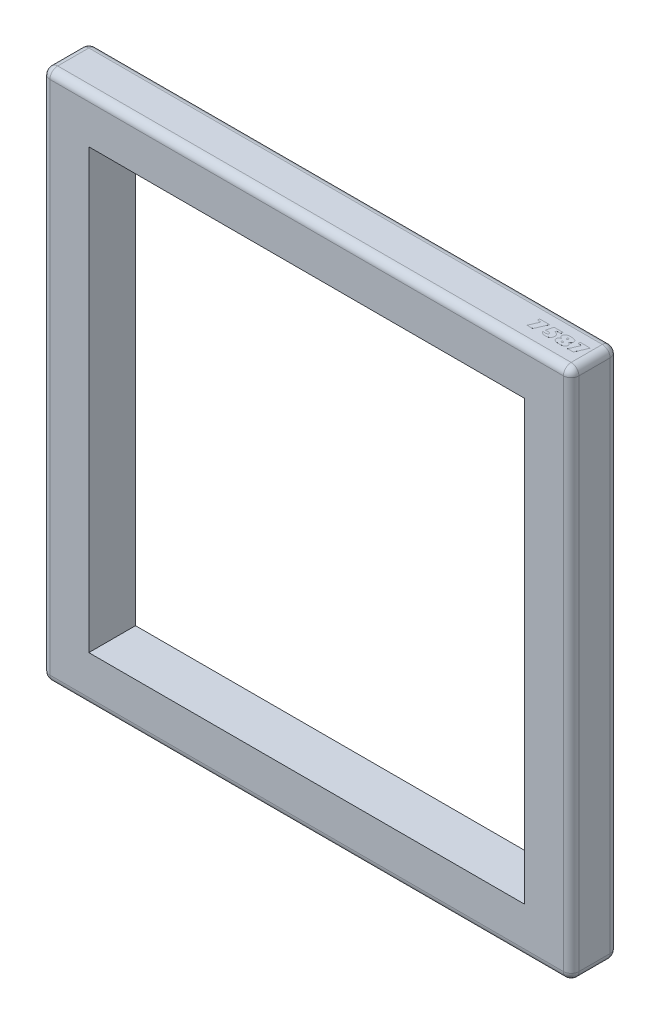
from build123d import *

# Parameters (mm, degrees)
SKETCH2_W           = 863.6
SKETCH2_H           = 867.537
SKETCH2_W_2         = 711.2
SKETCH2_H_2         = 715.137
BOSS_EXTRUDE1_DEPTH = 76.2
FILLET1_R           = 12.7
BOSS_EXTRUDE2_DEPTH = 0.0254


with BuildPart() as part:
    # Sketch2 → Boss-Extrude1 (new body)
    with BuildSketch(Plane.XY):
        with Locations((-393.7, 357.5685)):
            Rectangle(SKETCH2_W, SKETCH2_H)
        with Locations((-393.7, 357.5685)):
            Rectangle(SKETCH2_W_2, SKETCH2_H_2, mode=Mode.SUBTRACT)
    extrude(amount=-BOSS_EXTRUDE1_DEPTH)

    # Fillet1
    fillet1_edges = [part.edges().sort_by_distance(p)[0] for p in [
        (-825.5, 357.5685, 0),
        (-393.7, -76.2, -76.2),
        (38.1, -76.2, -38.1),
        (-393.7, -76.2, 0),
        (-825.5, -76.2, -38.1),
        (-825.5, 357.5685, -76.2),
        (38.1, 357.5685, -76.2),
        (-393.7, 791.337, -76.2),
        (38.1, 791.337, -38.1),
        (-825.5, 791.337, -38.1),
        (-393.7, 791.337, 0),
        (38.1, 357.5685, 0),
    ]]
    fillet(fillet1_edges, radius=FILLET1_R)

    # Sketch3 → Boss-Extrude2 (add)
    # profile 1 of 4: a face of its own
    with BuildSketch(Plane(origin=(0, 791.337, 0), x_dir=(1, 0, 0), z_dir=(0, 1, 0))):
        Polygon((-53.727973938, 29.183715642), (-63.107004166, 29.183715642), (-56.273603439, 45.043212712), (-61.845453262, 45.043212712), (-61.845453262, 48.407348454), (-45.445291519, 48.407348454), align=None)
    # profile 2 of 4: a face of its own
    with BuildSketch(Plane(origin=(0, 791.337, 0), x_dir=(1, 0, 0), z_dir=(0, 1, 0))):
        with BuildLine():
            Line((-23.878778458, 48.407348454), (-23.878778458, 45.043212712))
            Line((-23.878778458, 45.043212712), (-30.415564537, 45.043212712))
            Line((-30.415564537, 45.043212712), (-31.087640762, 42.3999632))
            add(Edge.make_bspline(
                [(-31.087640762, 42.3999632), (-30.831811244, 42.379100971), (-30.334066113, 42.338511156), (-29.614826101, 42.209941881), (-28.940065984, 42.049535514), (-28.313604943, 41.833604056), (-27.732477764, 41.574614404), (-27.194899243, 41.270210143), (-26.706602743, 40.916008536), (-26.263625689, 40.520640154), (-25.875107785, 40.083089795), (-25.528510647, 39.617600592), (-25.243902994, 39.112435936), (-25.003916003, 38.578369918), (-24.826649975, 38.007590908), (-24.693993169, 37.407561962), (-24.614139054, 36.775192587), (-24.604552672, 36.342745372), (-24.599664688, 36.12224561)],
                knots=[0, 0, 0, 0, 1.217686971, 2.369147101, 3.464164001, 4.50681488, 5.509294206, 6.480446105, 7.433459119, 8.367357942, 9.292867885, 10.206577389, 11.116571509, 12.039427559, 12.980684995, 13.947849621, 14.953632596, 16, 16, 16, 16], degree=3))
            add(Edge.make_bspline(
                [(-24.599664688, 36.12224561), (-24.607417191, 35.866624391), (-24.622647202, 35.364449315), (-24.726758385, 34.626809341), (-24.913647914, 33.927084456), (-25.164264692, 33.258886209), (-25.495528697, 32.630585214), (-25.890779335, 32.030279269), (-26.367533148, 31.472437933), (-26.907128117, 30.952217408), (-27.5014239, 30.479052042), (-28.146940343, 30.071337705), (-28.828230186, 29.717451143), (-29.554837166, 29.437932283), (-30.319333275, 29.214234944), (-31.125350741, 29.060413609), (-31.971060297, 28.957337583), (-32.549116472, 28.948130033), (-32.844800949, 28.943420232)],
                knots=[0, 0, 0, 0, 1.001936993, 1.968333403, 2.91189952, 3.835723145, 4.759455594, 5.690079001, 6.647318133, 7.629130035, 8.624331341, 9.619109397, 10.617364864, 11.628542224, 12.665579242, 13.7353975, 14.841621563, 16, 16, 16, 16], degree=3))
            add(Edge.make_bspline(
                [(-32.844800949, 28.943420232), (-33.101507962, 28.946487711), (-33.609386292, 28.952556522), (-34.36090623, 29.017180928), (-35.094759884, 29.107666611), (-35.810732408, 29.243612964), (-36.506867362, 29.420975914), (-37.18740516, 29.630616446), (-37.846794244, 29.882178444), (-38.481499361, 30.169794932), (-39.08043473, 30.484905918), (-39.617170269, 30.846322504), (-40.104486261, 31.223484988), (-40.525551786, 31.63756861), (-40.887652114, 32.081803708), (-41.18745197, 32.554303331), (-41.430573251, 33.056788661), (-41.54106327, 33.409780207), (-41.596810341, 33.587879956)],
                knots=[0, 0, 0, 0, 1.163667245, 2.302240872, 3.417871835, 4.515255233, 5.603932667, 6.673677212, 7.742352562, 8.801402191, 9.832207051, 10.806445689, 11.731706445, 12.622549934, 13.477799023, 14.324761977, 15.154768787, 16, 16, 16, 16], degree=3))
            Line((-41.596810341, 33.587879956), (-41.44662571, 33.749328435))
            add(Edge.make_bspline(
                [(-41.44662571, 33.749328435), (-41.104249796, 33.63762941), (-40.416252372, 33.413172495), (-39.345082895, 33.194536847), (-38.245246924, 33.053352598), (-37.500973816, 33.036801624), (-37.125062943, 33.028442204)],
                knots=[0, 0, 0, 0, 0.98115573, 1.97161245, 2.975519971, 4, 4, 4, 4], degree=3))
            add(Edge.make_bspline(
                [(-37.125062943, 33.028442204), (-36.984840212, 33.030849008), (-36.710328955, 33.03556076), (-36.307815406, 33.065254664), (-35.925067716, 33.116679868), (-35.564256733, 33.192651602), (-35.22342245, 33.285318922), (-34.904203976, 33.403114031), (-34.602547116, 33.536512813), (-34.324720328, 33.693984479), (-34.076237396, 33.869503965), (-33.853817736, 34.05306707), (-33.668442319, 34.254849344), (-33.514049055, 34.466848971), (-33.395103102, 34.692079501), (-33.312850774, 34.928892961), (-33.256625922, 35.177204271), (-33.252425165, 35.348480123), (-33.250299454, 35.435150922)],
                knots=[0, 0, 0, 0, 1.331593224, 2.606833628, 3.830465399, 4.995919138, 6.106066241, 7.181376235, 8.224006534, 9.235276467, 10.207957358, 11.110353994, 11.968214499, 12.802704758, 13.594817664, 14.376700065, 15.178560784, 16, 16, 16, 16], degree=3))
            add(Edge.make_bspline(
                [(-33.250299454, 35.435150922), (-33.252651667, 35.523014262), (-33.257227707, 35.693945228), (-33.308112247, 35.940282072), (-33.388112061, 36.170370919), (-33.498966651, 36.385388907), (-33.650408597, 36.576895155), (-33.824708625, 36.758332143), (-34.036164735, 36.917864746), (-34.279092805, 37.060081481), (-34.550936828, 37.189340622), (-34.857559896, 37.296040157), (-35.194637921, 37.390324528), (-35.564035453, 37.46311021), (-35.963426969, 37.524652246), (-36.396078022, 37.563221946), (-36.860618252, 37.59123405), (-37.1813343, 37.593095747), (-37.346585274, 37.594054997)],
                knots=[0, 0, 0, 0, 0.814446033, 1.584438367, 2.32285386, 3.071071758, 3.816851133, 4.580773861, 5.400915678, 6.265507767, 7.190421024, 8.189801626, 9.274824997, 10.436656683, 11.681899897, 13.023836303, 14.466512816, 16, 16, 16, 16], degree=3))
            add(Edge.make_bspline(
                [(-37.346585274, 37.594054997), (-37.530661765, 37.591326454), (-37.890626915, 37.585990735), (-38.417258544, 37.539809773), (-38.91561654, 37.466850854), (-39.385877264, 37.360118583), (-39.82764793, 37.22774345), (-40.240206811, 37.060220478), (-40.626339426, 36.866713218), (-40.863557527, 36.710330726), (-40.981053352, 36.632873357)],
                knots=[0, 0, 0, 0, 1.156825485, 2.262194689, 3.320222464, 4.320246568, 5.290750089, 6.21544117, 7.116095219, 8, 8, 8, 8], degree=3))
            Line((-40.981053352, 36.632873357), (-41.180047989, 36.801831067))
            Line((-41.180047989, 36.801831067), (-38.296503067, 48.407348454))
            Line((-38.296503067, 48.407348454), (-23.878778458, 48.407348454))
        make_face()
    # profile 3 of 4: a face of its own
    with BuildSketch(Plane(origin=(0, 791.337, 0), x_dir=(1, 0, 0), z_dir=(0, 1, 0))):
        with BuildLine():
            Line((-5.563762665, 38.68664819), (-5.563762665, 38.637838185))
            add(Edge.make_bspline(
                [(-5.563762665, 38.637838185), (-5.380573806, 38.595893009), (-5.024416344, 38.514342812), (-4.51227853, 38.364555617), (-4.035891823, 38.190912547), (-3.594381064, 37.996635171), (-3.185749403, 37.784052795), (-2.816605473, 37.544099577), (-2.476511515, 37.29119859), (-2.174128601, 37.012082439), (-1.910809561, 36.709619283), (-1.679492739, 36.388575451), (-1.482473103, 36.045854998), (-1.326295435, 35.67945723), (-1.199868114, 35.294328742), (-1.115710744, 34.886146416), (-1.061749026, 34.457890026), (-1.054436931, 34.165006958), (-1.050714493, 34.015906155)],
                knots=[0, 0, 0, 0, 1.272070742, 2.473171623, 3.609658422, 4.702216877, 5.736899567, 6.724002855, 7.679735686, 8.603071686, 9.503737951, 10.390184178, 11.278208182, 12.173798879, 13.08212411, 14.017702024, 14.990852492, 16, 16, 16, 16], degree=3))
            add(Edge.make_bspline(
                [(-1.050714493, 34.015906155), (-1.058150502, 33.803962751), (-1.072591266, 33.392367637), (-1.177907969, 32.796738677), (-1.358591913, 32.244512908), (-1.618310436, 31.738346992), (-1.941386363, 31.269651149), (-2.347747043, 30.854380611), (-2.82167441, 30.481178262), (-3.367733393, 30.147637793), (-3.996605242, 29.864640349), (-4.703146373, 29.613442668), (-5.49587634, 29.404772499), (-6.373542808, 29.239872428), (-7.335693888, 29.104993428), (-8.384327523, 29.00876957), (-9.518019777, 28.953534065), (-10.302025063, 28.946868361), (-10.707586289, 28.943420232)],
                knots=[0, 0, 0, 0, 0.829914899, 1.611698737, 2.360447216, 3.097077995, 3.832811089, 4.581671893, 5.363348137, 6.190638346, 7.081174267, 8.059558398, 9.124987239, 10.288298897, 11.555600899, 12.929230815, 14.411509545, 16, 16, 16, 16], degree=3))
            add(Edge.make_bspline(
                [(-10.707586289, 28.943420232), (-11.098148003, 28.946492508), (-11.853486991, 28.952434232), (-12.948369628, 29.012930794), (-13.965713708, 29.112780633), (-14.906847673, 29.251214746), (-15.772480556, 29.423018646), (-16.558975357, 29.644731025), (-17.268572819, 29.903521154), (-17.905364186, 30.196153588), (-18.460618911, 30.542000933), (-18.9488499, 30.920293491), (-19.359184058, 31.349810362), (-19.695500149, 31.821468574), (-19.959512369, 32.33568844), (-20.142572518, 32.893081029), (-20.253361517, 33.49213308), (-20.267230751, 33.90528503), (-20.274347305, 34.117280782)],
                knots=[0, 0, 0, 0, 1.536874697, 2.97228667, 4.313637076, 5.558361364, 6.714578418, 7.784185359, 8.770526994, 9.684887053, 10.536399623, 11.339456744, 12.10932516, 12.865089986, 13.611813465, 14.374988553, 15.166177183, 16, 16, 16, 16], degree=3))
            add(Edge.make_bspline(
                [(-20.274347305, 34.117280782), (-20.270200543, 34.26256821), (-20.262097812, 34.546458299), (-20.21452133, 34.963012537), (-20.126600439, 35.35842056), (-20.008816317, 35.736078895), (-19.847465092, 36.089720765), (-19.660532797, 36.427855663), (-19.433918045, 36.742991123), (-19.17365591, 37.037496199), (-18.877917452, 37.308737422), (-18.549600726, 37.560452531), (-18.188022886, 37.79521037), (-17.787838273, 38.003151984), (-17.355971334, 38.195883534), (-16.888191699, 38.362922988), (-16.388363304, 38.514272259), (-16.040895273, 38.595946337), (-15.86267376, 38.637838185)],
                knots=[0, 0, 0, 0, 1.007039593, 1.967744645, 2.900036035, 3.810693587, 4.703666785, 5.589068155, 6.484397043, 7.387631027, 8.308311454, 9.260719666, 10.251910049, 11.291696361, 12.382812732, 13.526935413, 14.731528448, 16, 16, 16, 16], degree=3))
            Line((-15.86267376, 38.637838185), (-15.86267376, 38.690402806))
            add(Edge.make_bspline(
                [(-15.86267376, 38.690402806), (-16.032239702, 38.733346027), (-16.361461904, 38.816722805), (-16.834299882, 38.974064483), (-17.275982051, 39.143134629), (-17.684018386, 39.337030318), (-18.061726783, 39.545090408), (-18.402508664, 39.779324364), (-18.714740331, 40.028028796), (-18.992861615, 40.298271504), (-19.238078928, 40.589672237), (-19.453557702, 40.897831892), (-19.635605803, 41.227197761), (-19.781020002, 41.576467347), (-19.894370093, 41.945066184), (-19.976745709, 42.331870533), (-20.026642286, 42.739068892), (-20.03155038, 43.016829147), (-20.034051895, 43.158395589)],
                knots=[0, 0, 0, 0, 1.255790759, 2.43819125, 3.576521912, 4.650022137, 5.680165864, 6.669873966, 7.615971983, 8.543965312, 9.449666279, 10.347258669, 11.240339608, 12.146753866, 13.059341379, 14.005994254, 14.98371242, 16, 16, 16, 16], degree=3))
            add(Edge.make_bspline(
                [(-20.034051895, 43.158395589), (-20.028191787, 43.376599021), (-20.016769067, 43.80192846), (-19.909545434, 44.419217303), (-19.731721482, 44.99534549), (-19.488008647, 45.53205271), (-19.17133978, 46.026998025), (-18.783912072, 46.480553932), (-18.327511508, 46.894668276), (-17.799234927, 47.264416453), (-17.202536076, 47.589819802), (-16.540041933, 47.874706252), (-15.809481988, 48.114013308), (-15.012688322, 48.312024662), (-14.146947195, 48.464242276), (-13.214170654, 48.571400915), (-12.214068209, 48.634709974), (-11.524935, 48.643242069), (-11.16940403, 48.647643864)],
                knots=[0, 0, 0, 0, 0.891193006, 1.737143263, 2.550936645, 3.349739008, 4.138654415, 4.944224268, 5.780657282, 6.650576706, 7.573157482, 8.553737035, 9.593786134, 10.711530976, 11.906517722, 13.183671401, 14.547026866, 16, 16, 16, 16], degree=3))
            add(Edge.make_bspline(
                [(-11.16940403, 48.647643864), (-10.755065561, 48.644574952), (-9.953453729, 48.638637593), (-8.794815467, 48.578234397), (-7.723309319, 48.479813972), (-6.739806648, 48.336635524), (-5.842104486, 48.160726713), (-5.030898525, 47.940158914), (-4.305805433, 47.679736647), (-3.665431763, 47.374234439), (-3.100077157, 47.029083266), (-2.616305898, 46.627967746), (-2.203613324, 46.179710422), (-1.86652042, 45.681715437), (-1.610116806, 45.130417979), (-1.420420003, 44.534378857), (-1.312227476, 43.88568979), (-1.29822375, 43.437886136), (-1.291009903, 43.207205594)],
                knots=[0, 0, 0, 0, 1.561832224, 3.021643617, 4.372290806, 5.616668553, 6.766784001, 7.818652016, 8.782831497, 9.667023252, 10.48919952, 11.273294509, 12.027995661, 12.779104701, 13.530435974, 14.312313512, 15.130609072, 16, 16, 16, 16], degree=3))
            add(Edge.make_bspline(
                [(-1.291009903, 43.207205594), (-1.292999726, 43.061824175), (-1.29689054, 42.777551536), (-1.353572837, 42.362334133), (-1.433343235, 41.967056984), (-1.550996481, 41.592362857), (-1.701790789, 41.237717744), (-1.885353639, 40.902101222), (-2.106035655, 40.589837345), (-2.354855368, 40.293397786), (-2.640979664, 40.019517363), (-2.962555913, 39.768960099), (-3.312404596, 39.533953296), (-3.698241185, 39.324660411), (-4.116128877, 39.133293822), (-4.567211806, 38.960348416), (-5.053088435, 38.810482905), (-5.390573776, 38.728645212), (-5.563762665, 38.68664819)],
                knots=[0, 0, 0, 0, 1.023193054, 2.000708151, 2.94642329, 3.860932408, 4.761483966, 5.657103327, 6.549724173, 7.450448299, 8.379416456, 9.333517028, 10.318831624, 11.344603714, 12.421453346, 13.554359624, 14.744959596, 16, 16, 16, 16], degree=3))
        make_face()
        with BuildLine():
            add(Edge.make_bspline(
                [(-9.220758438, 43.011965573), (-9.225500891, 43.116359547), (-9.234732619, 43.319574401), (-9.316302021, 43.612725003), (-9.454087762, 43.877947762), (-9.638407901, 44.113572104), (-9.856571353, 44.312096543), (-10.105796486, 44.460509022), (-10.382027649, 44.543929954), (-10.573148022, 44.556333618), (-10.670040131, 44.562621892)],
                knots=[0, 0, 0, 0, 1.061125011, 2.065601642, 3.068380359, 4.085141921, 5.095498623, 6.054684182, 7.013785139, 8, 8, 8, 8], degree=3))
            add(Edge.make_bspline(
                [(-10.670040131, 44.562621892), (-10.765758093, 44.556535566), (-10.953381142, 44.54460536), (-11.224900257, 44.458678567), (-11.472371491, 44.312304402), (-11.690088541, 44.113369559), (-11.875521863, 43.878988753), (-12.007856821, 43.611634429), (-12.090611521, 43.319718784), (-12.099656727, 43.116408547), (-12.10430336, 43.011965573)],
                knots=[0, 0, 0, 0, 0.978777253, 1.918565414, 2.882906505, 3.898693777, 4.920920336, 5.923295946, 6.933171543, 8, 8, 8, 8], degree=3))
            add(Edge.make_bspline(
                [(-12.10430336, 43.011965573), (-12.099681578, 42.907517334), (-12.09068475, 42.704196847), (-12.007273284, 42.411267422), (-11.874584652, 42.140946585), (-11.691560388, 41.89970546), (-11.472417832, 41.696904208), (-11.225242209, 41.546935837), (-10.954023196, 41.455859419), (-10.765845395, 41.444542991), (-10.670040131, 41.43878156)],
                knots=[0, 0, 0, 0, 1.060088928, 2.063584786, 3.071027467, 4.107006263, 5.12492551, 6.089660347, 7.027406026, 8, 8, 8, 8], degree=3))
            add(Edge.make_bspline(
                [(-10.670040131, 41.43878156), (-10.574294245, 41.444715339), (-10.385041969, 41.456444108), (-10.11188886, 41.545852545), (-9.863610389, 41.698033823), (-9.640988542, 41.899315525), (-9.454744394, 42.140857262), (-9.317062338, 42.410312405), (-9.234610854, 42.704306249), (-9.225459567, 42.907554462), (-9.220758438, 43.011965573)],
                knots=[0, 0, 0, 0, 0.968366345, 1.914082617, 2.874623988, 3.897501903, 4.936654694, 5.945385113, 6.94451902, 8, 8, 8, 8], degree=3))
        make_face(mode=Mode.SUBTRACT)
        with BuildLine():
            add(Edge.make_bspline(
                [(-10.602457047, 33.028442204), (-10.49439496, 33.033589647), (-10.283057813, 33.043656508), (-9.978150603, 33.119773697), (-9.699587468, 33.249574612), (-9.453724297, 33.427115858), (-9.240801923, 33.635259327), (-9.094910037, 33.881323697), (-8.995720756, 34.144963055), (-8.985624542, 34.330372119), (-8.980463028, 34.425159276)],
                knots=[0, 0, 0, 0, 1.091016555, 2.133702324, 3.151951295, 4.176461657, 5.186829325, 6.134486384, 7.046288638, 8, 8, 8, 8], degree=3))
            add(Edge.make_bspline(
                [(-8.980463028, 34.425159276), (-8.986094036, 34.527172102), (-8.997172881, 34.727879372), (-9.089521627, 35.015987509), (-9.249458561, 35.273189185), (-9.463373404, 35.495829128), (-9.719388257, 35.679892389), (-10.008354595, 35.818131676), (-10.330399764, 35.897999898), (-10.554454519, 35.907227025), (-10.670040131, 35.911987126)],
                knots=[0, 0, 0, 0, 0.974473097, 1.91724749, 2.857662375, 3.848472636, 4.851932662, 5.858743863, 6.895366451, 8, 8, 8, 8], degree=3))
            add(Edge.make_bspline(
                [(-10.670040131, 35.911987126), (-10.78432562, 35.906922475), (-11.005517228, 35.897120197), (-11.324932293, 35.821464611), (-11.612960786, 35.687545662), (-11.867437361, 35.508276093), (-12.079622018, 35.29226534), (-12.233852189, 35.042459051), (-12.328661924, 34.764669984), (-12.339207057, 34.569834042), (-12.34459877, 34.470214665)],
                knots=[0, 0, 0, 0, 1.113384153, 2.154877523, 3.175588003, 4.190963022, 5.174474003, 6.105518633, 7.03135402, 8, 8, 8, 8], degree=3))
            add(Edge.make_bspline(
                [(-12.34459877, 34.470214665), (-12.339694795, 34.370447411), (-12.330141986, 34.176103542), (-12.228194033, 33.89882058), (-12.068996963, 33.648284631), (-11.847627108, 33.431076099), (-11.584140627, 33.252719078), (-11.283554037, 33.123216277), (-10.953387654, 33.04206301), (-10.721839738, 33.033075851), (-10.602457047, 33.028442204)],
                knots=[0, 0, 0, 0, 0.947430485, 1.845568532, 2.778995879, 3.75769185, 4.780279891, 5.795532449, 6.863409042, 8, 8, 8, 8], degree=3))
        make_face(mode=Mode.SUBTRACT)
    # profile 4 of 4: a face of its own
    with BuildSketch(Plane(origin=(0, 791.337, 0), x_dir=(1, 0, 0), z_dir=(0, 1, 0))):
        Polygon((12.593559265, 29.183715642), (3.214529037, 29.183715642), (10.047929764, 45.043212712), (4.476079941, 45.043212712), (4.476079941, 48.407348454), (20.876241684, 48.407348454), align=None)
    extrude(amount=BOSS_EXTRUDE2_DEPTH)


solid = part.part
